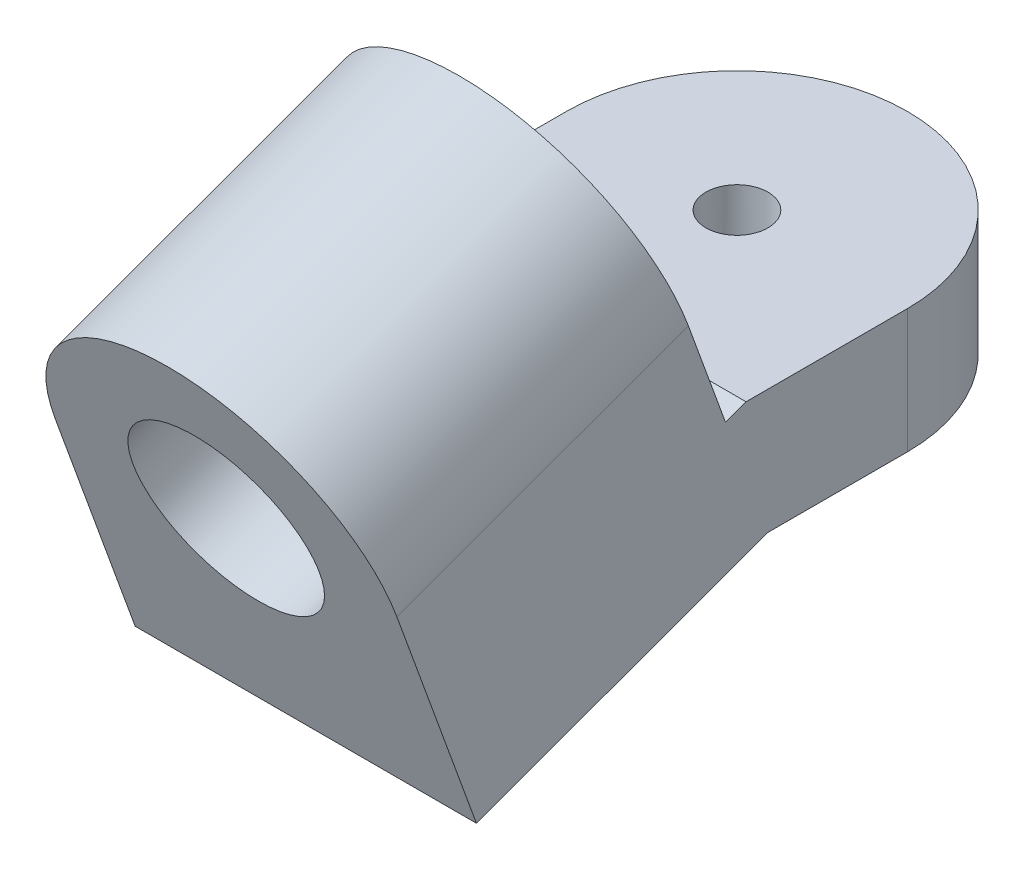
from build123d import *

# Parameters (mm, degrees)
EXTRUDE_THIN1_DEPTH = 5.5
FILLET1_R           = 5.5
SKETCH3_R           = 1
CUT_EXTRUDE1_DEPTH  = 23.726524062
SKETCH4_R           = 2.25
CUT_EXTRUDE2_DEPTH  = 2
SKETCH5_R           = 3
BOSS_EXTRUDE1_DEPTH = 10


with BuildPart() as part:
    # Sketch2 → Extrude-Thin1 (new, symmetric)
    with BuildSketch(Plane(origin=(0, 0, 0), x_dir=(0, 0, -1), z_dir=(1, 0, 0))):
        Polygon((0, 0), (-10, 0), (-19.396926208, -3.420201433), (-20.765006781, 0.33856905), (-10.705307923, 4), (0, 4), align=None)
    extrude(amount=EXTRUDE_THIN1_DEPTH, both=True)

    # Fillet1
    fillet1_edges = [part.edges().sort_by_distance(p)[0] for p in [
        (-5.5, 2, 0),
        (5.5, 2, 0),
    ]]
    fillet(fillet1_edges, radius=FILLET1_R - 0.0001)  # a hair under: the kernel refuses the full size

    # Sketch3 → Cut-Extrude1 (cut, through all)
    with BuildSketch(Plane(origin=(0, 4, 0), x_dir=(1, 0, 0), z_dir=(0, 1, 0))):
        with Locations(Location((0, -5.5, 0), (0, 0, 270))):
            Circle(SKETCH3_R)
    extrude(amount=-CUT_EXTRUDE1_DEPTH, mode=Mode.SUBTRACT)

    # Sketch4 → Cut-Extrude2 (cut)
    with BuildSketch(Plane.XZ):
        with Locations(Location((0, 5.5, 0), (0, 0, 270))):
            Circle(SKETCH4_R)
    extrude(amount=-CUT_EXTRUDE2_DEPTH, mode=Mode.SUBTRACT)

    # Sketch5 → Boss-Extrude1 (add)
    with BuildSketch(Plane(origin=(0, -6.634139482, 18.227148423), x_dir=(1, 0, 0), z_dir=(0, -0.34202014332567143, 0.9396926207859075))):
        with BuildLine():
            Line((5.5, 7.420201433), (5.5, 10.920201433))
            ThreePointArc((5.5, 10.920201433), (0, 16.420201433), (-5.5, 10.920201433))
            Line((-5.5, 10.920201433), (-5.5, 7.420201433))
            Line((-5.5, 7.420201433), (-5.5, 3.420201433))
            Line((-5.5, 3.420201433), (5.5, 3.420201433))
            Line((5.5, 3.420201433), (5.5, 7.420201433))
        make_face()
        with Locations(Location((0, 10.920201433, 0), (0, 0, 270))):
            Circle(SKETCH5_R, mode=Mode.SUBTRACT)
    extrude(amount=-BOSS_EXTRUDE1_DEPTH)


solid = part.part
